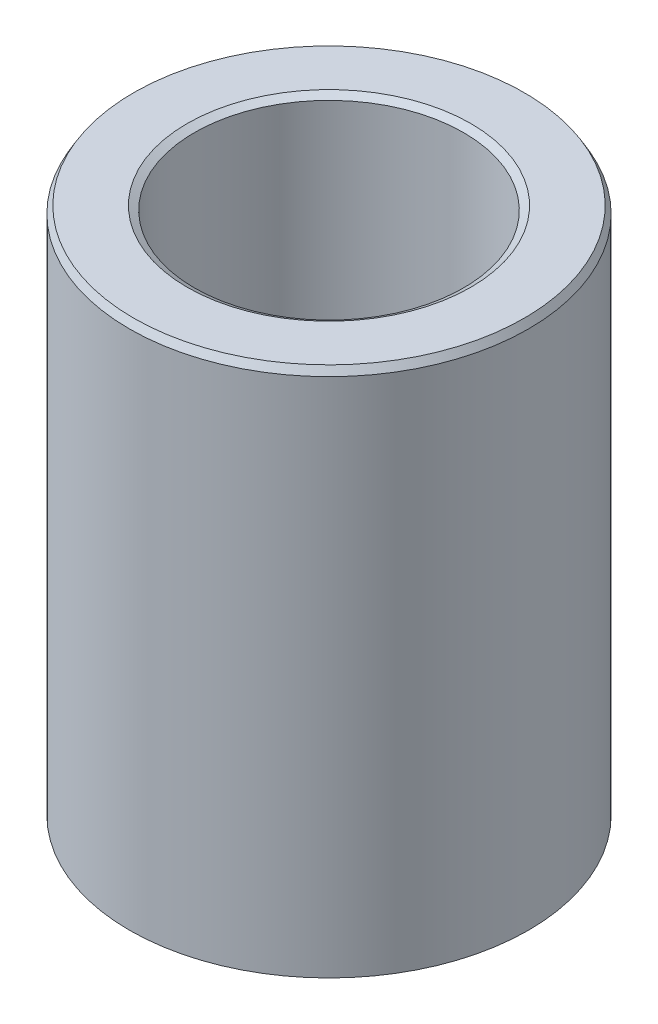
from build123d import *
from OCP.BRepFilletAPI import BRepFilletAPI_MakeChamfer

# Parameters (mm, degrees)
SKETCH1_R           = 7.5
BOSS_EXTRUDE1_DEPTH = 20.007657566
SKETCH2_R           = 5.05966414
CUT_EXTRUDE1_DEPTH  = 23.645228223
CHAMFER1_SIZE       = 0.272782128
CHAMFER1_SIZE2      = 0.157490835


with BuildPart() as part:
    # Sketch1 → Boss-Extrude1 (new body)
    with BuildSketch(Plane(origin=(0, 0, 0), x_dir=(1, 0, 0), z_dir=(0, 1, 0))):
        Circle(SKETCH1_R)
    extrude(amount=BOSS_EXTRUDE1_DEPTH)

    # Sketch2 → Cut-Extrude1 (cut, through all)
    with BuildSketch(Plane(origin=(0, 0, 0), x_dir=(1, 0, 0), z_dir=(0, 1, 0))):
        Circle(SKETCH2_R)
    extrude(amount=CUT_EXTRUDE1_DEPTH, mode=Mode.SUBTRACT)

    # Chamfer1: one chamfer whose edges measure the first distance from different faces: ONE call of the kernel's chamfer builder (chamfer() names one face for all edges)
    chamfer1_edges_1 = [part.edges().sort_by_distance(p)[0] for p in [
        (-5.05966414, 20.007657566, 0),
    ]]
    chamfer1_side_1 = [part.faces().sort_by_distance(p)[0] for p in [
        (-7.287867966, 20.007657566, 0),
    ]]
    chamfer1_edges_2 = [part.edges().sort_by_distance(p)[0] for p in [
        (-5.05966414, 0, 0),
    ]]
    chamfer1_side_2 = [part.faces().sort_by_distance(p)[0] for p in [
        (-5.05966414, 10.003828783, 0),
    ]]
    chamfer1_edges_3 = [part.edges().sort_by_distance(p)[0] for p in [
        (-7.5, 0, 0),
    ]]
    chamfer1_side_3 = [part.faces().sort_by_distance(p)[0] for p in [
        (-7.287867966, 0, 0),
    ]]
    chamfer1_edges_4 = [part.edges().sort_by_distance(p)[0] for p in [
        (-7.5, 20.007657566, 0),
    ]]
    chamfer1_side_4 = [part.faces().sort_by_distance(p)[0] for p in [
        (-7.5, 10.003828783, 0),
    ]]
    chamfer1 = BRepFilletAPI_MakeChamfer(part.part.solid().wrapped)
    for e in chamfer1_edges_1:
        chamfer1.Add(CHAMFER1_SIZE, CHAMFER1_SIZE2, e.wrapped, chamfer1_side_1[0].wrapped)  # the first distance lies on this face
    for e in chamfer1_edges_2:
        chamfer1.Add(CHAMFER1_SIZE, CHAMFER1_SIZE2, e.wrapped, chamfer1_side_2[0].wrapped)  # the first distance lies on this face
    for e in chamfer1_edges_3:
        chamfer1.Add(CHAMFER1_SIZE, CHAMFER1_SIZE2, e.wrapped, chamfer1_side_3[0].wrapped)  # the first distance lies on this face
    for e in chamfer1_edges_4:
        chamfer1.Add(CHAMFER1_SIZE, CHAMFER1_SIZE2, e.wrapped, chamfer1_side_4[0].wrapped)  # the first distance lies on this face
    add(Compound.cast(chamfer1.Shape()), mode=Mode.REPLACE)


solid = part.part
